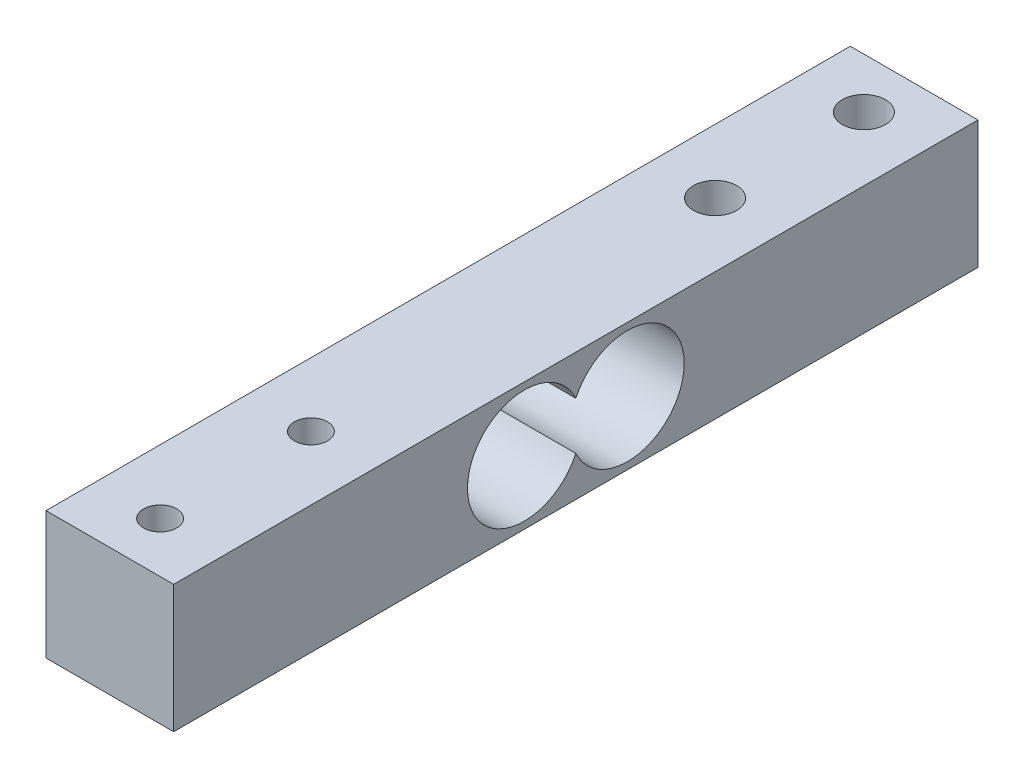
from build123d import *

# Parameters (mm, degrees)
SKETCH1_W           = 12.7
SKETCH1_H           = 12.7
BOSS_EXTRUDE1_DEPTH = 80
CUT_EXTRUDE1_DEPTH  = 82.250307692
SKETCH3_R           = 2.15
CUT_EXTRUDE2_DEPTH  = 82.250307692
SKETCH4_R           = 1.65
CUT_EXTRUDE3_DEPTH  = 82.250307692


with BuildPart() as part:
    # Sketch1 → Boss-Extrude1 (new body)
    with BuildSketch(Plane.XY):
        Rectangle(SKETCH1_W, SKETCH1_H)
    extrude(amount=BOSS_EXTRUDE1_DEPTH)

    # Sketch2 → Cut-Extrude1 (cut, through all)
    with BuildSketch(Plane(origin=(6.35, 0, 0), x_dir=(0, 0, -1), z_dir=(1, 0, 0))):
        with BuildLine():
            ThreePointArc((-40, 2.375), (-50.776585121, 0), (-40, -2.375))
            ThreePointArc((-40, -2.375), (-29.223414879, 0), (-40, 2.375))
        make_face()
    extrude(amount=-CUT_EXTRUDE1_DEPTH, mode=Mode.SUBTRACT)

    # Sketch3 → Cut-Extrude2 (cut, through all)
    with BuildSketch(Plane(origin=(0, 6.35, 0), x_dir=(1, 0, 0), z_dir=(0, 1, 0))):
        with Locations((0, -5)):
            Circle(SKETCH3_R)
        with Locations((0, -19.8)):
            Circle(SKETCH3_R)
    extrude(amount=-CUT_EXTRUDE2_DEPTH, mode=Mode.SUBTRACT)

    # Sketch4 → Cut-Extrude3 (cut, through all)
    with BuildSketch(Plane(origin=(0, 6.35, 0), x_dir=(1, 0, 0), z_dir=(0, 1, 0))):
        with Locations((0, -75)):
            Circle(SKETCH4_R)
        with Locations((0, -60)):
            Circle(SKETCH4_R)
    extrude(amount=-CUT_EXTRUDE3_DEPTH, mode=Mode.SUBTRACT)


solid = part.part
